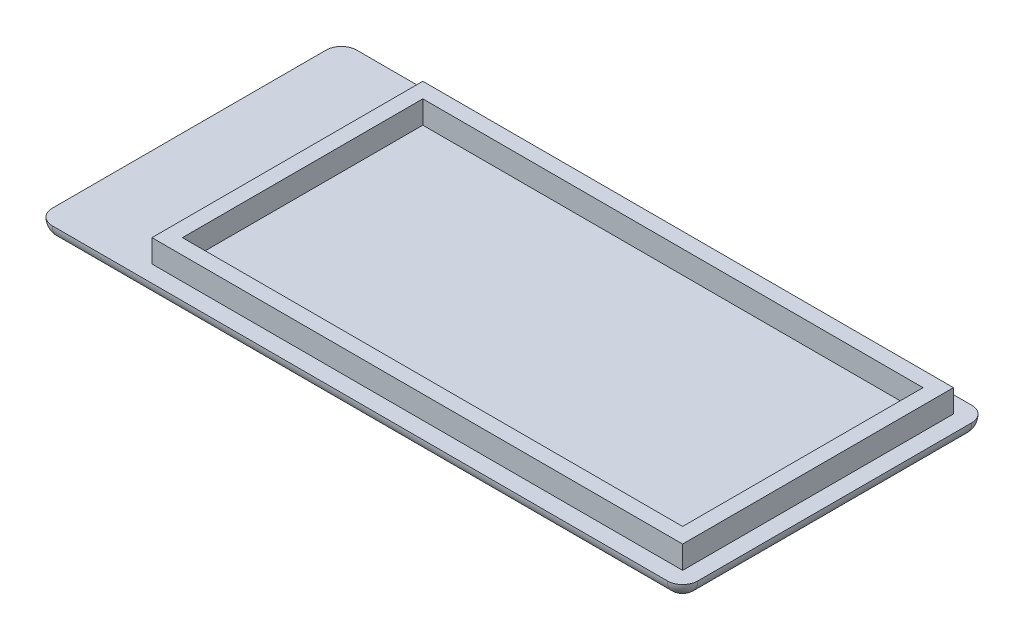
from build123d import *

# Parameters (mm, degrees)
SKETCH1_W           = 42.42562
SKETCH1_H           = 1
BOSS_EXTRUDE1_DEPTH = 19.99996
FILLET1_R           = 1
SKETCH2_W           = 34.8742
SKETCH2_H           = 17.79996
SKETCH2_W_2         = 32.8742
SKETCH2_H_2         = 15.79996
BOSS_EXTRUDE2_DEPTH = 1.5


with BuildPart() as part:
    # Sketch1 → Boss-Extrude1 (new body)
    with BuildSketch(Plane.XY):
        with Locations((21.21281, 0.5)):
            Rectangle(SKETCH1_W, SKETCH1_H)
    extrude(amount=BOSS_EXTRUDE1_DEPTH)

    # Fillet1
    fillet1_edges = [part.edges().sort_by_distance(p)[0] for p in [
        (42.42562, 0.5, 19.99996),
        (0, 0.5, 19.99996),
        (42.42562, 0.5, 0),
        (21.21281, 0, 0),
        (0, 0.5, 0),
        (21.21281, 0, 19.99996),
        (42.42562, 0, 9.99998),
        (0, 0, 9.99998),
    ]]
    fillet(fillet1_edges, radius=FILLET1_R - 0.0001)  # a hair under: the kernel refuses the full size

    # Sketch2 → Boss-Extrude2 (add)
    with BuildSketch(Plane(origin=(0, 1, 0), x_dir=(1, 0, 0), z_dir=(0, 1, 0))):
        with Locations((23.88852, -9.99998)):
            Rectangle(SKETCH2_W, SKETCH2_H)
        with Locations((23.88852, -9.99998)):
            Rectangle(SKETCH2_W_2, SKETCH2_H_2, mode=Mode.SUBTRACT)
    extrude(amount=BOSS_EXTRUDE2_DEPTH)


solid = part.part
